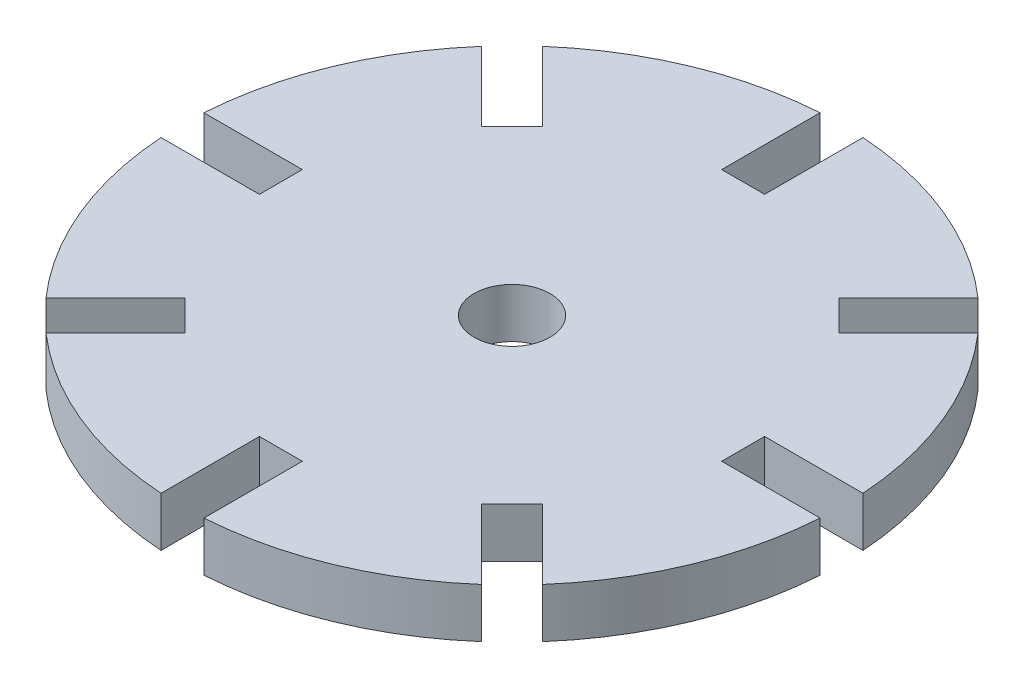
from build123d import *

# Parameters (mm, degrees)
BOSS_EXTRUDE1_DEPTH      = 1.5
BOSS_EXTRUDE1_DEPTH_BACK = 1.5
SKETCH1_R                = 20
SKETCH1_R_2              = 2.3
SKETCH2_W                = 12
SKETCH2_H                = 2.6
CUT_EXTRUDE1_DEPTH       = 29.442925307
CIRPATTERN1_COUNT        = 8


with BuildPart() as part:
    # Sketch1 → Boss-Extrude1 (new, two sides: drawn at the far end of the back side and taken through both)
    with BuildSketch(Plane(origin=(0, 0, 0), x_dir=(1, 0, 0), z_dir=(0, 1, 0)).offset(-BOSS_EXTRUDE1_DEPTH_BACK)):
        Circle(SKETCH1_R)
        Circle(SKETCH1_R_2, mode=Mode.SUBTRACT)
    extrude(amount=BOSS_EXTRUDE1_DEPTH + BOSS_EXTRUDE1_DEPTH_BACK)

    # Sketch2 → Cut-Extrude1 (cut, through all)
    with BuildSketch(Plane(origin=(0, 1.5, 0), x_dir=(1, 0, 0), z_dir=(0, 1, 0))):
        with Locations((20, 0)):
            Rectangle(SKETCH2_W, SKETCH2_H)
    cut_extrude1 = extrude(amount=-CUT_EXTRUDE1_DEPTH, mode=Mode.SUBTRACT)

    # CirPattern1: Cut-Extrude1 ×8 about axis
    cirpattern1_axis = Axis((0, 1.74625, 0), (0, -1, 0))
    for i in range(1, CIRPATTERN1_COUNT):
        add(cut_extrude1.rotate(cirpattern1_axis, i * 360 / CIRPATTERN1_COUNT), mode=Mode.SUBTRACT)


solid = part.part
